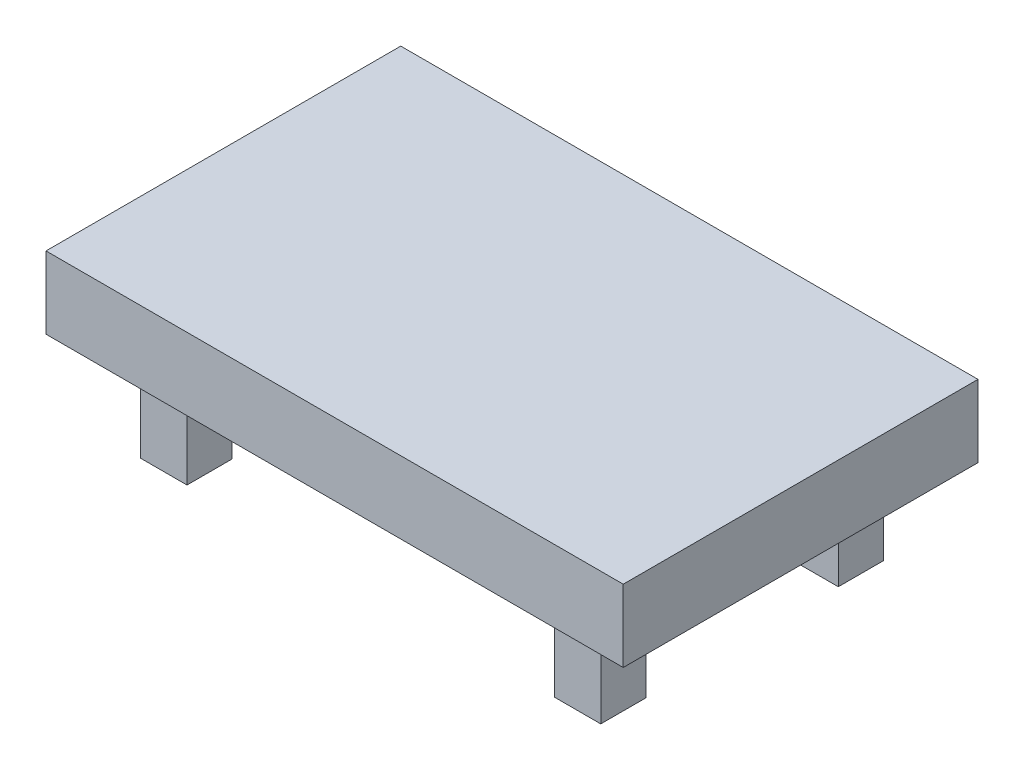
from build123d import *

# Parameters (mm, degrees)
SKETCH1_W      = 2438.4
SKETCH1_H      = 1498.6
EXTRUDE1_DEPTH = 304.8
SKETCH2_W      = 195.697690122
SKETCH2_H      = 190.200978844
EXTRUDE2_DEPTH = 406.4


with BuildPart() as part:
    # Sketch1 → Extrude1 (new body)
    with BuildSketch(Plane(origin=(0, 0, 0), x_dir=(1, 0, 0), z_dir=(0, 1, 0))):
        Rectangle(SKETCH1_W, SKETCH1_H)
    extrude(amount=EXTRUDE1_DEPTH)

    # Sketch2 → Extrude2 (add)
    with BuildSketch(Plane.XZ):
        with Locations((873.896069805, 501.711153283)):
            Rectangle(SKETCH2_W, SKETCH2_H)
        with Locations((-873.896069805, 501.711153283)):
            Rectangle(SKETCH2_W, SKETCH2_H)
        with Locations((-873.896069805, -501.711153283)):
            Rectangle(SKETCH2_W, SKETCH2_H)
        with Locations((873.896069805, -501.711153283)):
            Rectangle(SKETCH2_W, SKETCH2_H)
    extrude(amount=EXTRUDE2_DEPTH)


solid = part.part
